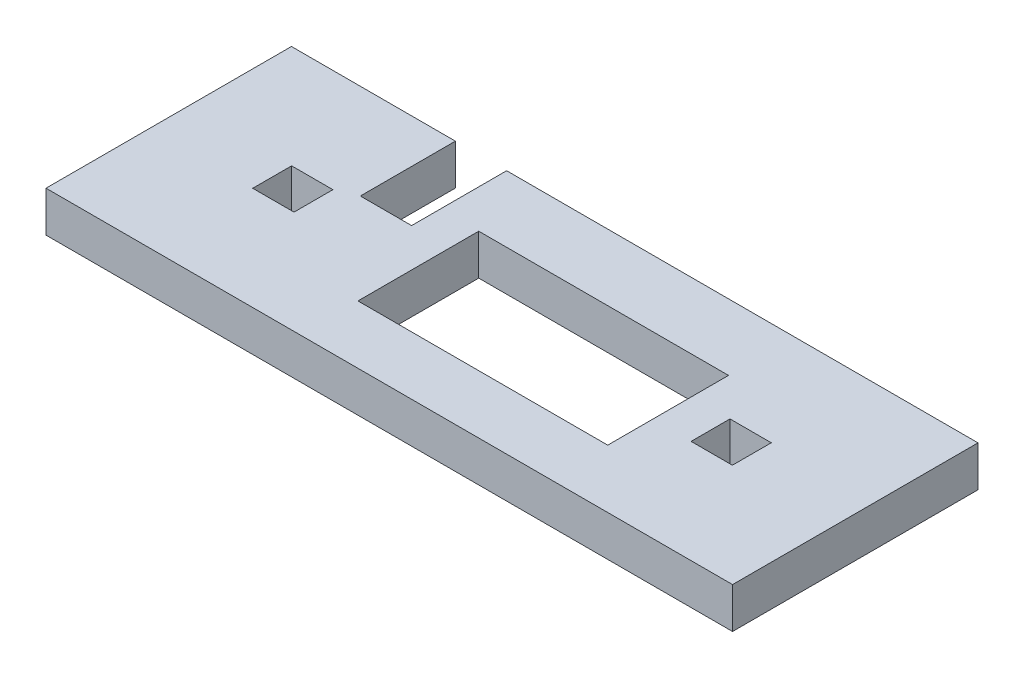
from build123d import *

# Parameters (mm, degrees)
SKETCH1_W           = 214.4
SKETCH1_H           = 76.65
SKETCH1_W_2         = 12.9
SKETCH1_H_2         = 12.15
BOSS_EXTRUDE1_DEPTH = 12.7
SKETCH2_W           = 16
SKETCH2_H           = 29.683575912
SKETCH2_W_2         = 78
SKETCH2_H_2         = 37.723139769
CUT_EXTRUDE1_DEPTH  = 229.04357588


with BuildPart() as part:
    # Sketch1 → Boss-Extrude1 (new body)
    with BuildSketch(Plane(origin=(0, 0, 0), x_dir=(1, 0, 0), z_dir=(0, 1, 0))):
        with Locations((107.2, 38.325)):
            Rectangle(SKETCH1_W, SKETCH1_H)
        with Locations((38.75, 38.325)):
            Rectangle(SKETCH1_W_2, SKETCH1_H_2, mode=Mode.SUBTRACT)
        with Locations((175.65, 38.325)):
            Rectangle(SKETCH1_W_2, SKETCH1_H_2, mode=Mode.SUBTRACT)
    extrude(amount=BOSS_EXTRUDE1_DEPTH)

    # Sketch2 → Cut-Extrude1 (cut, through all)
    with BuildSketch(Plane(origin=(0, 12.7, 0), x_dir=(1, 0, 0), z_dir=(0, 1, 0))):
        with Locations((59.2, 61.808212044)):
            Rectangle(SKETCH2_W, SKETCH2_H)
        with Locations((118.2, 37.078640757)):
            Rectangle(SKETCH2_W_2, SKETCH2_H_2)
    extrude(amount=-CUT_EXTRUDE1_DEPTH, mode=Mode.SUBTRACT)


solid = part.part
